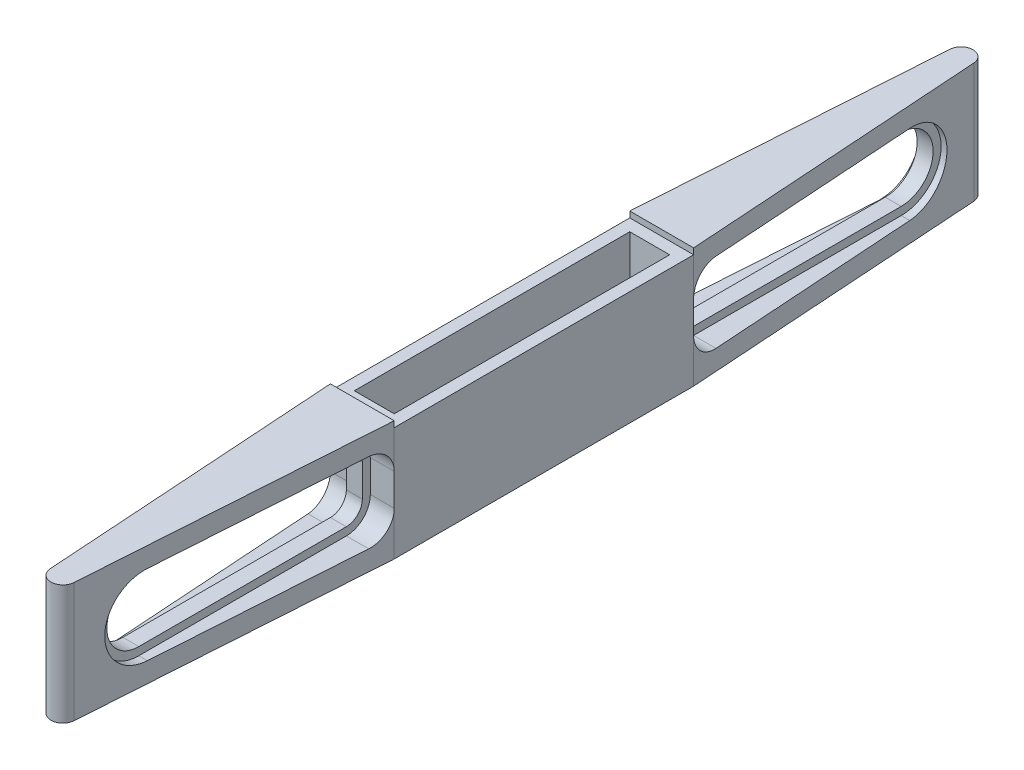
from build123d import *

# Parameters (mm, degrees)
BASE_EXTRUDE_DEPTH   = 30
CUT_EXTRUDE1_DEPTH   = 6
FILLET1_R            = 6
FILLET1_OF_MIRROR1_R = 6
MIRROR2_START        = -8
MIRROR2_DEPTH        = 6
MIRROR2_START_2      = 2
MIRROR2_2_DEPTH      = 6
SKETCH5_W            = 16
SKETCH5_H            = 75
CUT_EXTRUDE3_DEPTH   = 1.5
SKETCH6_W            = 10
SKETCH6_H            = 69
CUT_EXTRUDE4_DEPTH   = 18.5
CUT_EXTRUDE5_DEPTH   = 120.750782878


# Read off the part's stored shape, not the designer's step: Mirror2
with BuildPart() as part:
    # Sketch1 → Base-Extrude (new body)
    with BuildSketch(Plane(origin=(0, 0, 0), x_dir=(1, 0, 0), z_dir=(0, 1, 0))):
        with BuildLine():
            Line((8, 37.5), (2.993373056, 112.699293126))
            ThreePointArc((2.993373056, 112.699293126), (0, 115.5), (-2.993373056, 112.699293126))
            Line((-2.993373056, 112.699293126), (-8, 37.5))
            Line((-8, 37.5), (-8, -37.5))
            Line((-8, -37.5), (-2.993373056, -112.699293126))
            ThreePointArc((-2.993373056, -112.699293126), (0, -115.5), (2.993373056, -112.699293126))
            Line((2.993373056, -112.699293126), (8, -37.5))
            Line((8, -37.5), (8, 37.5))
        make_face()
    extrude(amount=BASE_EXTRUDE_DEPTH)

    # Sketch2 → Cut-Extrude1 (cut)
    with BuildSketch(Plane(origin=(8, 0, 0), x_dir=(0, 0, -1), z_dir=(1, 0, 0))):
        with BuildLine():
            Line((-37.5, 5), (-95.5, 5))
            ThreePointArc((-95.5, 5), (-105.5, 15), (-95.5, 25))
            Line((-95.5, 25), (-37.5, 25))
            Line((-37.5, 25), (-37.5, 5))
        make_face()
    cut_extrude1 = extrude(amount=-CUT_EXTRUDE1_DEPTH, mode=Mode.SUBTRACT)

    # Fillet1
    fillet1_edges = [part.edges().sort_by_distance(p)[0] for p in [
        (5, 25, 37.5),
        (5, 5, 37.5),
    ]]
    fillet(fillet1_edges, radius=FILLET1_R)

    # Mirror1: Cut-Extrude1 across plane
    add(cut_extrude1.mirror(Plane(origin=(0, 0, 0), x_dir=(0, 0, 1), z_dir=(1, 0, 0))), mode=Mode.SUBTRACT)

    # Fillet1 of Mirror1
    fillet1_of_mirror1_edges = [part.edges().sort_by_distance(p)[0] for p in [
        (-5, 25, 37.5),
        (-5, 5, 37.5),
    ]]
    fillet(fillet1_of_mirror1_edges, radius=FILLET1_OF_MIRROR1_R)

    # Mirror2 outline → Mirror2 (cut)
    with BuildSketch(Plane.YZ.offset(MIRROR2_START)):
        with BuildLine():
            Line((5, -43.5), (5, -95.5))
            ThreePointArc((5, -95.5), (15, -105.5), (25, -95.5))
            Line((25, -95.5), (25, -43.5))
            ThreePointArc((25, -43.5), (23.242640687, -39.257359313), (19, -37.5))
            Line((19, -37.5), (11, -37.5))
            ThreePointArc((11, -37.5), (6.757359313, -39.257359313), (5, -43.5))
        make_face()
    extrude(amount=MIRROR2_DEPTH, mode=Mode.SUBTRACT)

    # Mirror2 2 outline → Mirror2 2 (cut)
    with BuildSketch(Plane.YZ.offset(MIRROR2_START_2)):
        with BuildLine():
            Line((5, -43.5), (5, -95.5))
            ThreePointArc((5, -95.5), (15, -105.5), (25, -95.5))
            Line((25, -95.5), (25, -43.5))
            ThreePointArc((25, -43.5), (23.242640687, -39.257359313), (19, -37.5))
            Line((19, -37.5), (11, -37.5))
            ThreePointArc((11, -37.5), (6.757359313, -39.257359313), (5, -43.5))
        make_face()
    extrude(amount=MIRROR2_2_DEPTH, mode=Mode.SUBTRACT)

    # Sketch5 → Cut-Extrude3 (cut)
    with BuildSketch(Plane(origin=(0, 30, 0), x_dir=(-1, 0, 0), z_dir=(0, 1, 0))):
        Rectangle(SKETCH5_W, SKETCH5_H)
    extrude(amount=-CUT_EXTRUDE3_DEPTH, mode=Mode.SUBTRACT)

    # Sketch6 → Cut-Extrude4 (cut)
    with BuildSketch(Plane(origin=(0, 28.5, 0), x_dir=(1, 0, 0), z_dir=(0, 1, 0))):
        Rectangle(SKETCH6_W, SKETCH6_H)
    extrude(amount=-CUT_EXTRUDE4_DEPTH, mode=Mode.SUBTRACT)

    # Sketch7 → Cut-Extrude5 (cut, through all)
    with BuildSketch(Plane(origin=(2, 0, 0), x_dir=(0, 0, -1), z_dir=(1, 0, 0))):
        with BuildLine():
            Line((39.5, 11), (39.5, 19))
            ThreePointArc((39.5, 19), (40.671572875, 21.828427125), (43.5, 23))
            Line((43.5, 23), (95.5, 23))
            ThreePointArc((95.5, 23), (103.5, 15), (95.5, 7))
            Line((95.5, 7), (43.5, 7))
            ThreePointArc((43.5, 7), (40.671572875, 8.171572875), (39.5, 11))
        make_face()
        with BuildLine():
            Line((-95.5, 7), (-43.5, 7))
            ThreePointArc((-43.5, 7), (-40.671572875, 8.171572875), (-39.5, 11))
            Line((-39.5, 11), (-39.5, 19))
            ThreePointArc((-39.5, 19), (-40.671572875, 21.828427125), (-43.5, 23))
            Line((-43.5, 23), (-95.5, 23))
            ThreePointArc((-95.5, 23), (-103.5, 15), (-95.5, 7))
        make_face()
    extrude(amount=-CUT_EXTRUDE5_DEPTH, mode=Mode.SUBTRACT)


solid = part.part
